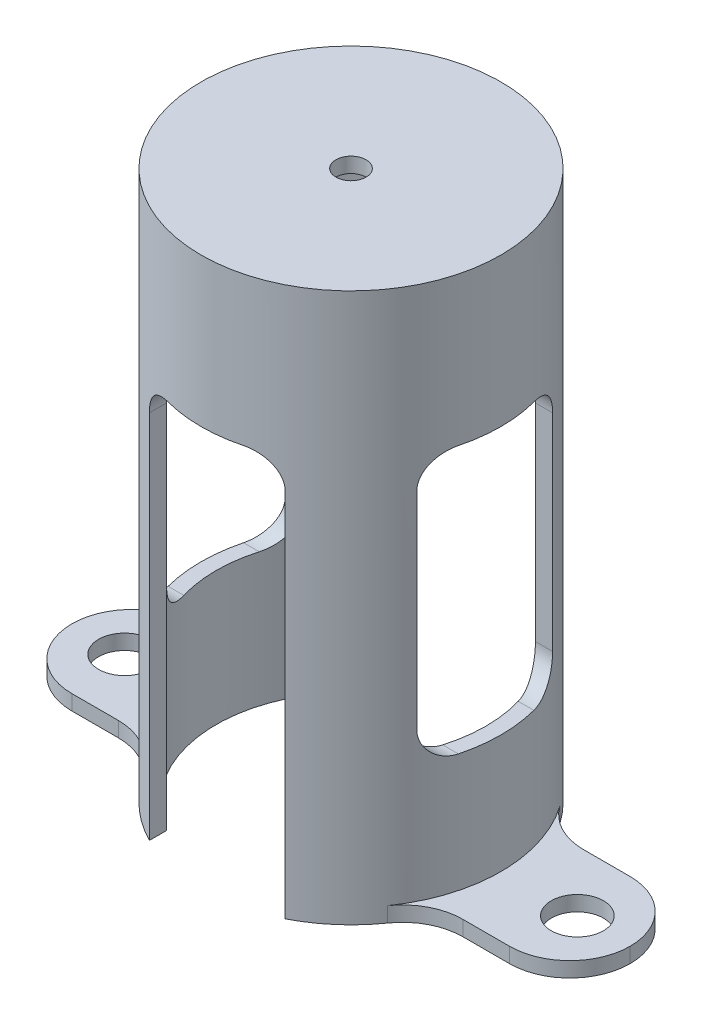
from build123d import *

# Parameters (mm, degrees)
SKETCH2_R           = 9.9375
BOSS_EXTRUDE1_DEPTH = 35.384
SKETCH4_R           = 1
CUT_EXTRUDE2_DEPTH  = 39.072762817
BOSS_EXTRUDE2_START = 1
SKETCH11_R          = 8.9375
BOSS_EXTRUDE2_DEPTH = 1
SKETCH12_R          = 8.9375
CUT_EXTRUDE7_DEPTH  = 34.384
CUT_EXTRUDE8_START  = -1
CUT_EXTRUDE8_DEPTH  = 26.538
SKETCH14_W          = 9
SKETCH14_H          = 17.692
CUT_EXTRUDE9_DEPTH  = 61.852537846
FILLET3_R           = 2
FILLET4_R           = 4
CUT_EXTRUDE10_REACH = 43.146
SKETCH15_R          = 1.7272


# Read off the part's stored shape, not the designer's step: Cut-Extrude8
with BuildPart() as part:
    # Sketch2 → Boss-Extrude1 (new body)
    with BuildSketch(Plane(origin=(0, 0, 0), x_dir=(1, 0, 0), z_dir=(0, 1, 0))):
        with Locations(Location((0, 0, 0), (0, 0, 270))):
            Circle(SKETCH2_R)
    extrude(amount=BOSS_EXTRUDE1_DEPTH)

    # Sketch4 → Cut-Extrude2 (cut, through all)
    with BuildSketch(Plane(origin=(0, 35.384, 0), x_dir=(1, 0, 0), z_dir=(0, 1, 0))):
        with Locations(Location((0, 0, 0), (0, 0, 270))):
            Circle(SKETCH4_R)
    extrude(amount=-CUT_EXTRUDE2_DEPTH, mode=Mode.SUBTRACT)

    # Sketch11 → Boss-Extrude2 (add)
    with BuildSketch(Plane.XZ.offset(BOSS_EXTRUDE2_START)):
        with BuildLine():
            Line((9.096917404, 4), (18.5, 4))
            Line((18.5, 4), (18.5, -4))
            Line((18.5, -4), (9.096917404, -4))
            ThreePointArc((9.096917404, -4), (0, -9.9375), (-9.096917404, -4))
            Line((-9.096917404, -4), (-18.5, -4))
            Line((-18.5, -4), (-18.5, 4))
            Line((-18.5, 4), (-9.096917404, 4))
            ThreePointArc((-9.096917404, 4), (0, 9.9375), (9.096917404, 4))
        make_face()
        with Locations(Location((0, 0, 0), (0, 0, 270))):
            Circle(SKETCH11_R, mode=Mode.SUBTRACT)
    extrude(amount=-BOSS_EXTRUDE2_DEPTH)

    # Sketch12 → Cut-Extrude7 (cut)
    with BuildSketch(Plane.XZ):
        with Locations(Location((0, 0, 0), (0, 0, 270))):
            Circle(SKETCH12_R)
    extrude(amount=-CUT_EXTRUDE7_DEPTH, mode=Mode.SUBTRACT)

    # Cut-Extrude8 outline → Cut-Extrude8 (cut)
    with BuildSketch(Plane(origin=(0, 0, 0), x_dir=(1, 0, 0), z_dir=(0, 1, 0)).offset(CUT_EXTRUDE8_START)):
        with BuildLine():
            ThreePointArc((4.5, -7.721975541), (0, -8.9375), (-4.5, -7.721975541))
            Line((-4.5, -7.721975541), (-4.5, -8.860243013))
            ThreePointArc((-4.5, -8.860243013), (0, -9.9375), (4.5, -8.860243013))
            Line((4.5, -8.860243013), (4.5, -7.721975541))
        make_face()
        with BuildLine():
            Line((-4.5, 8.860243013), (-4.5, 7.721975541))
            ThreePointArc((-4.5, 7.721975541), (0, 8.9375), (4.5, 7.721975541))
            Line((4.5, 7.721975541), (4.5, 8.860243013))
            ThreePointArc((4.5, 8.860243013), (0, 9.9375), (-4.5, 8.860243013))
        make_face()
    extrude(amount=CUT_EXTRUDE8_DEPTH, mode=Mode.SUBTRACT)

    # Sketch14 → Cut-Extrude9 (cut, through all)
    with BuildSketch(Plane(origin=(30, 0, 0), x_dir=(0, 0, -1), z_dir=(1, 0, 0))):
        with Locations((0, 16.692)):
            Rectangle(SKETCH14_W, SKETCH14_H)
    extrude(amount=-CUT_EXTRUDE9_DEPTH, mode=Mode.SUBTRACT)

    # Fillet3
    fillet3_edges = [part.edges().sort_by_distance(p)[0] for p in [
        (4.5, 25.538, 8.291109277),
        (4.5, 25.538, -8.291109277),
        (-4.5, 25.538, -8.291109277),
        (-4.5, 25.538, 8.291109277),
        (8.291109277, 25.538, -4.5),
        (-8.291109277, 25.538, -4.5),
        (8.291109277, 7.846, -4.5),
        (-8.291109277, 7.846, -4.5),
        (-8.291109277, 7.846, 4.5),
        (8.291109277, 7.846, 4.5),
        (8.291109277, 25.538, 4.5),
        (-8.291109277, 25.538, 4.5),
    ]]
    fillet(fillet3_edges, radius=FILLET3_R)

    # Fillet4
    # the kernel refuses this fillet: 4 mm, written as the material it adds along each edge
    with BuildSketch(Plane(origin=(9.096917404, -1, -4), x_dir=(-0.4906341894667762, 0, -0.8713656477772574), z_dir=(0, 1, 0)), Plane(origin=(-9.096917404, -1, 4), x_dir=(0.49063418946677706, 0, 0.871365647777257), z_dir=(0, 1, 0))) as fillet4_piece_1:
        with BuildLine():
            CenterArc((2.349170519, -3.980589921), FILLET4_R, 95.646730554, 54.970995912)
            Line((-1.136292073, -2.018053163), (0, 0))
            ThreePointArc((0, 0), (0.977796106, -0.048221916), (1.955592212, 0))
        make_face()
    extrude(amount=1)
    with BuildSketch(Plane(origin=(9.096917404, -1, 4), x_dir=(-0.4906341894667768, 0, 0.8713656477772572), z_dir=(0, 1, 0)), Plane(origin=(-9.096917404, -1, -4), x_dir=(0.4906341894667772, 0, -0.8713656477772569), z_dir=(0, 1, 0))) as fillet4_piece_2:
        with BuildLine():
            CenterArc((2.349170519, 3.980589921), FILLET4_R, 209.382273534, 54.970995912)
            Line((-1.136292073, 2.018053163), (0, 0))
            ThreePointArc((0, 0), (0.977796106, 0.048221916), (1.955592212, 0))
        make_face()
    extrude(amount=1)
    # the kernel refuses this fillet: 4 mm, written as the material it takes off along each edge
    with BuildSketch(Plane(origin=(18.5, -11, -4), x_dir=(0, 0, 1), z_dir=(0, 1, 0)), Plane(origin=(18.5, -11, 4), x_dir=(-1, 0, 0), z_dir=(0, 1, 0))) as fillet4_2_piece_1:
        with BuildLine():
            CenterArc((FILLET4_R, -FILLET4_R), FILLET4_R, 90, 90)
            Line((0, -FILLET4_R), (0, 0))
            Line((0, 0), (FILLET4_R, 0))
        make_face()
    extrude(amount=21, mode=Mode.SUBTRACT)
    with BuildSketch(Plane(origin=(-18.5, -11, -4), x_dir=(0, 0, 1), z_dir=(0, 1, 0)), Plane(origin=(-18.5, -11, 4), x_dir=(1, 0, 0), z_dir=(0, 1, 0))) as fillet4_2_piece_2:
        with BuildLine():
            CenterArc((FILLET4_R, FILLET4_R), FILLET4_R, 180, 90)
            Line((0, FILLET4_R), (0, 0))
            Line((0, 0), (FILLET4_R, 0))
        make_face()
    extrude(amount=21, mode=Mode.SUBTRACT)

    # Sketch15 → Cut-Extrude10 (cut, up to next)
    with BuildSketch(Plane(origin=(0, 0, 0), x_dir=(1, 0, 0), z_dir=(0, 1, 0)), mode=Mode.PRIVATE) as cut_extrude10_sk1:
        with Locations(Location((-15, 0, 0), (0, 0, 270))):
            Circle(SKETCH15_R)
    cut_extrude10_tool1 = extrude(cut_extrude10_sk1.sketch, amount=-CUT_EXTRUDE10_REACH, mode=Mode.PRIVATE) & part.part
    # Sketch15 → Cut-Extrude10 (cut, up to next)
    with BuildSketch(Plane(origin=(0, 0, 0), x_dir=(1, 0, 0), z_dir=(0, 1, 0)), mode=Mode.PRIVATE) as cut_extrude10_sk2:
        with Locations(Location((15, 0, 0), (0, 0, 270))):
            Circle(SKETCH15_R)
    cut_extrude10_tool2 = extrude(cut_extrude10_sk2.sketch, amount=-CUT_EXTRUDE10_REACH, mode=Mode.PRIVATE) & part.part
    add(cut_extrude10_tool1.solids().sort_by_distance((-15, 0, 0))[0], mode=Mode.SUBTRACT)
    add(cut_extrude10_tool2.solids().sort_by_distance((15, 0, 0))[0], mode=Mode.SUBTRACT)


solid = part.part
